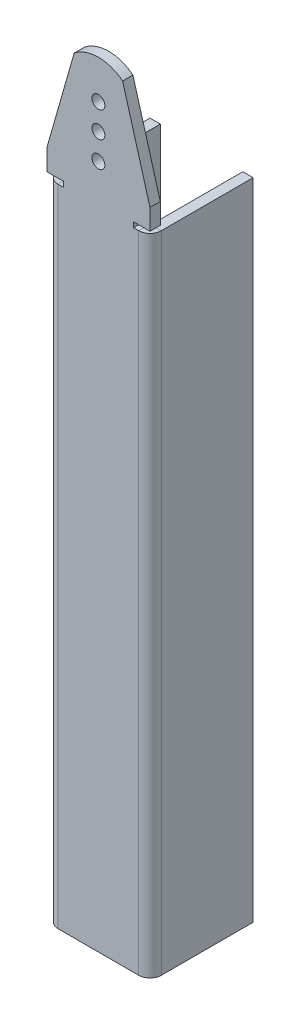
from build123d import *

# Parameters (mm, degrees)
SKETCH_1_R                        = 5
SM_BASE_FLANGE_2_DEPTH            = 8
SM_EDGE_FLANGE_4_STRIP_W          = 33.4732
SM_EDGE_FLANGE_4_STRIP_H          = 8
SM_EDGE_FLANGE_4_STRIP_CUT_DEPTH  = 500
SM_EDGE_FLANGE_4_RELIEF_W         = 37.4732
SM_EDGE_FLANGE_4_RELIEF_H         = 4
SM_EDGE_FLANGE_4_RELIEF_CUT_DEPTH = 8
SM_EDGE_FLANGE_4_DEPTH            = 500
SM_EDGE_FLANGE_8_STRIP_W          = 33.4732
SM_EDGE_FLANGE_8_STRIP_H          = 8
SM_EDGE_FLANGE_8_STRIP_CUT_DEPTH  = 500
SM_EDGE_FLANGE_8_RELIEF_W         = 37.4732
SM_EDGE_FLANGE_8_RELIEF_H         = 4
SM_EDGE_FLANGE_8_RELIEF_CUT_DEPTH = 8
SM_EDGE_FLANGE_8_DEPTH            = 500


# Sheet-metal steps are written as plain solids
with BuildPart() as part:
    # 草图1 → 基体-法兰2 (new body)
    with BuildSketch(Plane.XY):
        with BuildLine():
            Line((0, 0), (80, 0))
            Line((80, 0), (80, 520))
            Line((80, 520), (58.758007847, 594.277403974))
            ThreePointArc((58.758007847, 594.277403974), (39.983985428, 600.877915043), (21.209963009, 594.277403974))
            Line((21.209963009, 594.277403974), (0, 520.054307268))
            Line((0, 520.054307268), (0, 0))
        make_face()
        with Locations((39.983985428, 570.877915043)):
            Circle(SKETCH_1_R, mode=Mode.SUBTRACT)
        with Locations((39.983985428, 550.877915043)):
            Circle(SKETCH_1_R, mode=Mode.SUBTRACT)
        with Locations((39.983985428, 530.877915043)):
            Circle(SKETCH_1_R, mode=Mode.SUBTRACT)
    extrude(amount=-SM_BASE_FLANGE_2_DEPTH)

    # 边线-法兰4 strip (across the edge) → 边线-法兰4 strip cut (cut)
    with BuildSketch(Plane(origin=(0, 0, -8), x_dir=(1, 0, 0), z_dir=(0, 1, 0))):
        with Locations((-8, -4)):
            Rectangle(SM_EDGE_FLANGE_4_STRIP_W, SM_EDGE_FLANGE_4_STRIP_H)
    extrude(amount=SM_EDGE_FLANGE_4_STRIP_CUT_DEPTH, mode=Mode.SUBTRACT)

    # 边线-法兰4 relief (on the sheet) → 边线-法兰4 relief cut (cut)
    with BuildSketch(Plane(origin=(8.7366, 0, -8), x_dir=(1, 0, 0), z_dir=(0, 0, -1))):
        with Locations((-14.7366, -502)):
            Rectangle(SM_EDGE_FLANGE_4_RELIEF_W, SM_EDGE_FLANGE_4_RELIEF_H)
    extrude(amount=-SM_EDGE_FLANGE_4_RELIEF_CUT_DEPTH, mode=Mode.SUBTRACT)

    # 边线-法兰4 section (across the edge) → 边线-法兰4 (add)
    with BuildSketch(Plane(origin=(0, 0, -8), x_dir=(1, 0, 0), z_dir=(0, 1, 0))):
        with BuildLine():
            Line((0, 0.7366), (0, 72))
            Line((0, 72), (8, 72))
            Line((8, 72), (8, 0.7366))
            ThreePointArc((8, 0.7366), (8.215745145, 0.215745145), (8.7366, 0))
            Line((8.7366, 0), (8.7366, -8))
            ThreePointArc((8.7366, -8), (2.558890895, -5.441109105), (0, 0.7366))
        make_face()
    extrude(amount=SM_EDGE_FLANGE_4_DEPTH)

    # 边线-法兰8 strip (across the edge) → 边线-法兰8 strip cut (cut)
    with BuildSketch(Plane(origin=(80, 500, -8), x_dir=(-1, 0, 0), z_dir=(0, -1, 0))):
        with Locations((-8, -4)):
            Rectangle(SM_EDGE_FLANGE_8_STRIP_W, SM_EDGE_FLANGE_8_STRIP_H)
    extrude(amount=SM_EDGE_FLANGE_8_STRIP_CUT_DEPTH, mode=Mode.SUBTRACT)

    # 边线-法兰8 relief (on the sheet) → 边线-法兰8 relief cut (cut)
    with BuildSketch(Plane(origin=(71.2634, 500, -8), x_dir=(-1, 0, 0), z_dir=(0, 0, -1))):
        with Locations((-14.7366, 2)):
            Rectangle(SM_EDGE_FLANGE_8_RELIEF_W, SM_EDGE_FLANGE_8_RELIEF_H)
    extrude(amount=-SM_EDGE_FLANGE_8_RELIEF_CUT_DEPTH, mode=Mode.SUBTRACT)

    # 边线-法兰8 section (across the edge) → 边线-法兰8 (add)
    with BuildSketch(Plane(origin=(80, 500, -8), x_dir=(-1, 0, 0), z_dir=(0, -1, 0))):
        with BuildLine():
            Line((0, 0.7366), (0, 72))
            Line((0, 72), (8, 72))
            Line((8, 72), (8, 0.7366))
            ThreePointArc((8, 0.7366), (8.215745145, 0.215745145), (8.7366, 0))
            Line((8.7366, 0), (8.7366, -8))
            ThreePointArc((8.7366, -8), (2.558890895, -5.441109105), (0, 0.7366))
        make_face()
    extrude(amount=SM_EDGE_FLANGE_8_DEPTH)


solid = part.part
